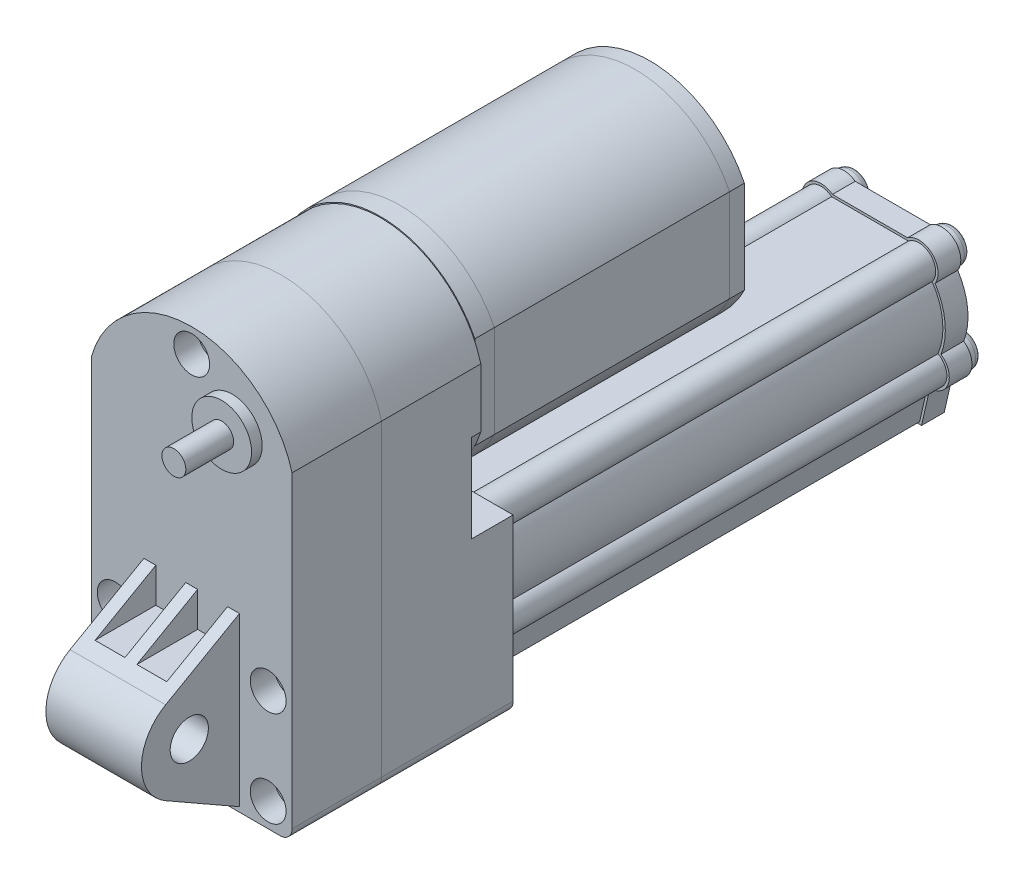
from build123d import *

# Parameters (mm, degrees)
BOSS_EXTRUDE1_DEPTH  = 19.05
SKETCH6_R            = 3.81
CUT_EXTRUDE2_DEPTH   = 5.08
SKETCH12_R           = 3.81
CUT_EXTRUDE3_DEPTH   = 5.08
BOSS_EXTRUDE11_DEPTH = 27.94
CUT_EXTRUDE4_DEPTH   = 8.89
CUT_EXTRUDE5_START   = -6.858
CUT_EXTRUDE5_DEPTH   = 6.858
BOSS_EXTRUDE13_DEPTH = 4.1402
BOSS_EXTRUDE14_DEPTH = 50
BOSS_EXTRUDE16_DEPTH = 3.1496
SKETCH26_R           = 11.938
BOSS_EXTRUDE17_DEPTH = 2.54
SKETCH27_R           = 11.938
BOSS_EXTRUDE20_DEPTH = 3.429
CHAMFER1_SIZE        = 2.286
FILLET11_R           = 2.54
CUT_EXTRUDE6_START   = -2.794
CUT_EXTRUDE6_DEPTH   = 2.794
BOSS_EXTRUDE21_DEPTH = 100
BOSS_EXTRUDE23_DEPTH = 4.826
SKETCH32_R           = 9.398
BOSS_EXTRUDE24_DEPTH = 8.128
SKETCH43_R           = 3.556
BOSS_EXTRUDE26_DEPTH = 2.54
FILLET13_R           = 1.27
SKETCH44_R           = 6.35
BOSS_EXTRUDE27_DEPTH = 2.2606
SKETCH45_R           = 2.54
BOSS_EXTRUDE28_DEPTH = 10.16
BOSS_EXTRUDE29_START = -11.176
SKETCH3_R            = 4.064
BOSS_EXTRUDE29_DEPTH = 20.32
SKETCH46_W           = 6.35
SKETCH46_H           = 7.366
CUT_EXTRUDE9_DEPTH   = 20.32
MOVE_START           = -1.75482957
MOVE_FACE1_DEPTH     = 20.32
MOVE_START_2         = 0.78517043
MOVE_FACE1_2_DEPTH   = 6.35
MOVE_START_3         = 9.67517043
MOVE_FACE1_3_DEPTH   = 6.35
MOVE_FACE1_4_DEPTH   = 20.32
MOVE_FACE1_5_DEPTH   = 2.54
MOVE_START_4         = 7.13517043
MOVE_FACE1_6_DEPTH   = 2.54
MOVE_START_5         = 16.02517043
MOVE_FACE1_7_DEPTH   = 2.54
FILLET14_R           = 2.54
FILLET15_R           = 2.54
SKETCH34_R           = 9.398
CUT_EXTRUDE11_DEPTH  = 185.928


# Read off the part's stored shape, not the designer's step: Cut-Extrude6, Move Face1
with BuildPart() as part:
    # Sketch1 → Boss-Extrude1 (new body)
    with BuildSketch(Plane.XY):
        with BuildLine():
            Line((-12.93082957, -18.491086285), (29.74117043, -18.491086285))
            Line((29.74117043, -18.491086285), (29.74117043, 49.580913715))
            ThreePointArc((29.74117043, 49.580913715), (8.40517043, 65.836892729), (-12.93082957, 49.580913715))
            Line((-12.93082957, 49.580913715), (-12.93082957, -18.491086285))
        make_face()
    extrude(amount=-BOSS_EXTRUDE1_DEPTH)

    # Sketch6 → Cut-Extrude2 (cut)
    with BuildSketch(Plane.XY):
        with Locations((-7.85082957, 6.908913715)):
            Circle(SKETCH6_R)
        with Locations((-7.85082957, -13.411086285)):
            Circle(SKETCH6_R)
        with Locations((24.66117043, 6.908913715)):
            Circle(SKETCH6_R)
        with Locations((24.66117043, -13.411086285)):
            Circle(SKETCH6_R)
    extrude(amount=-CUT_EXTRUDE2_DEPTH, mode=Mode.SUBTRACT)

    # Sketch12 → Cut-Extrude3 (cut)
    with BuildSketch(Plane.XY):
        with Locations((8.40517043, 60.756892729)):
            Circle(SKETCH12_R)
    extrude(amount=-CUT_EXTRUDE3_DEPTH, mode=Mode.SUBTRACT)

    # Sketch44 → Boss-Extrude27 (add)
    with BuildSketch(Plane.XY):
        with Locations(Location((17.04117043, 51.358913715, 0), (0, 0, 180))):
            Circle(SKETCH44_R)
    extrude(amount=BOSS_EXTRUDE27_DEPTH)

    # Sketch45 → Boss-Extrude28 (add)
    with BuildSketch(Plane.XY.offset(2.2606)):
        with Locations((17.04117043, 51.358913715)):
            Circle(SKETCH45_R)
    extrude(amount=BOSS_EXTRUDE28_DEPTH)

    # Sketch3 → Boss-Extrude29 (add)
    with BuildSketch(Plane.ZY.offset(12.93082957).offset(BOSS_EXTRUDE29_START)):
        with BuildLine():
            Line((0, -16.662286285), (0, 1.117779576))
            Line((0, 1.117779576), (0, 18.897713715))
            Line((0, 18.897713715), (15.701246407, 9.943459406))
            ThreePointArc((15.701246407, 9.943459406), (20.828056876, 1.117811735), (15.701302277, -7.70786839))
            Line((15.701302277, -7.70786839), (0, -16.662286285))
        make_face()
        with Locations((10.668054799, 1.117779576)):
            Circle(SKETCH3_R, mode=Mode.SUBTRACT)
    extrude(amount=-BOSS_EXTRUDE29_DEPTH)

    # Sketch46 → Cut-Extrude9 (cut)
    with BuildSketch(Plane.XY):
        with Locations((3.96017043, 15.214713715)):
            Rectangle(SKETCH46_W, SKETCH46_H)
        with Locations((12.85017043, 15.214713715)):
            Rectangle(SKETCH46_W, SKETCH46_H)
        with Locations((3.96017043, -12.979286285)):
            Rectangle(SKETCH46_W, SKETCH46_H)
        with Locations((12.85017043, -12.979286285)):
            Rectangle(SKETCH46_W, SKETCH46_H)
    extrude(amount=CUT_EXTRUDE9_DEPTH, mode=Mode.SUBTRACT)

    # Move Face1 outline → Move Face1 (cut)
    with BuildSketch(Plane.YZ.offset(MOVE_START)):
        with BuildLine():
            Line((9.140819406, 15.701246407), (18.095073715, 0))
            Line((18.095073715, 0), (18.897713715, 0))
            Line((18.897713715, 0), (9.943459406, 15.701246407))
            ThreePointArc((9.943459406, 15.701246407), (6.046592425, 19.552448201), (0.716459577, 20.820127714))
            ThreePointArc((0.716459577, 20.820127714), (5.591039303, 19.350826493), (9.140819406, 15.701246407))
        make_face()
        with BuildLine():
            ThreePointArc((0.716459576, 6.623918518), (-2.946220424, 10.668054799), (0.716459576, 14.71219108))
            ThreePointArc((0.716459576, 14.71219108), (-3.748860424, 10.668054799), (0.716459576, 6.623918518))
        make_face()
    extrude(amount=MOVE_FACE1_DEPTH, mode=Mode.SUBTRACT)

    # Move Face1 2 outline → Move Face1 2 (cut)
    with BuildSketch(Plane.YZ.offset(MOVE_START_2)):
        Polygon((11.531713715, 11.508823522), (10.729073716, 12.916249308), (10.729073715, 0), (11.531713715, 0), align=None)
    extrude(amount=MOVE_FACE1_2_DEPTH, mode=Mode.SUBTRACT)

    # Move Face1 3 outline → Move Face1 3 (cut)
    with BuildSketch(Plane.YZ.offset(MOVE_START_3)):
        Polygon((11.531713715, 11.508823522), (10.729073716, 12.916249308), (10.729073715, 0), (11.531713715, 0), align=None)
    extrude(amount=MOVE_FACE1_3_DEPTH, mode=Mode.SUBTRACT)

    # Move Face1 4 outline → Move Face1 4 (add)
    with BuildSketch(Plane.YZ.offset(MOVE_START)):
        with BuildLine():
            ThreePointArc((-7.70786839, 15.701302277), (-4.158092666, 19.350843192), (0.716459577, 20.820127714))
            ThreePointArc((0.716459577, 20.820127714), (-4.61364515, 19.552463801), (-8.51050839, 15.701302277))
            Line((-8.51050839, 15.701302277), (-10.098926285, 12.916059306))
            Line((-10.098926285, 12.916059306), (-10.098926285, 0))
            Line((-10.098926285, 0), (-9.296286285, 0))
            Line((-9.296286285, 0), (-9.296286285, 12.916059306))
            Line((-9.296286285, 12.916059306), (-7.70786839, 15.701302277))
        make_face()
        with BuildLine():
            ThreePointArc((0.716459576, 14.71219108), (4.379139576, 10.668054799), (0.716459576, 6.623918518))
            ThreePointArc((0.716459576, 6.623918518), (5.181779576, 10.668054799), (0.716459576, 14.71219108))
        make_face()
    extrude(amount=MOVE_FACE1_4_DEPTH)

    # Move Face1 5 outline → Move Face1 5 (add)
    with BuildSketch(Plane.YZ.offset(MOVE_START)):
        Polygon((-10.098926285, 11.508654222), (-10.098926285, 12.916059306), (-17.464926285, 0), (-16.662286285, 0), align=None)
    extrude(amount=MOVE_FACE1_5_DEPTH)

    # Move Face1 6 outline → Move Face1 6 (add)
    with BuildSketch(Plane.YZ.offset(MOVE_START_4)):
        Polygon((-10.098926285, 11.508654222), (-10.098926285, 12.916059306), (-17.464926285, 0), (-16.662286285, 0), align=None)
    extrude(amount=MOVE_FACE1_6_DEPTH)

    # Move Face1 7 outline → Move Face1 7 (add)
    with BuildSketch(Plane.YZ.offset(MOVE_START_5)):
        Polygon((-10.098926285, 11.508654222), (-10.098926285, 12.916059306), (-17.464926285, 0), (-16.662286285, 0), align=None)
    extrude(amount=MOVE_FACE1_7_DEPTH)

    # Fillet14
    fillet14_edges = [part.edges().sort_by_distance(p)[0] for p in [
        (29.74117043, -18.491086285, -9.525),
        (-12.93082957, -18.491086285, -9.525),
    ]]
    fillet(fillet14_edges, radius=FILLET14_R)


with BuildPart() as body_2:
    # Sketch17 → Boss-Extrude11 (new body)
    with BuildSketch(Plane(origin=(0, 0, -19.05), x_dir=(-1, 0, 0), z_dir=(0, 0, -1))):
        with BuildLine():
            Line((12.93082957, -18.491086285), (-29.74117043, -18.491086285))
            Line((-29.74117043, -18.491086285), (-29.74117043, 49.580913715))
            ThreePointArc((-29.74117043, 49.580913715), (-8.40517043, 65.836892729), (12.93082957, 49.580913715))
            Line((12.93082957, 49.580913715), (12.93082957, -18.491086285))
        make_face()
    extrude(amount=BOSS_EXTRUDE11_DEPTH)

    # Sketch18 → Cut-Extrude4 (cut)
    with BuildSketch(Plane(origin=(0, 0, -46.99), x_dir=(-1, 0, 0), z_dir=(0, 0, -1))):
        with BuildLine():
            Line((-29.74117043, 18.338913715), (12.93082957, 18.338913715))
            Line((12.93082957, 18.338913715), (12.93082957, 37.044777605))
            ThreePointArc((12.93082957, 37.044777605), (-8.40517043, 21.355135146), (-29.74117043, 37.044777605))
            Line((-29.74117043, 37.044777605), (-29.74117043, 18.338913715))
        make_face()
    extrude(amount=-CUT_EXTRUDE4_DEPTH, mode=Mode.SUBTRACT)

    # Sketch18<5> → Cut-Extrude5 (cut)
    with BuildSketch(Plane(origin=(0, 0, -46.99), x_dir=(-1, 0, 0), z_dir=(0, 0, -1)).offset(CUT_EXTRUDE5_START)):
        with BuildLine():
            Line((12.93082957, 49.580913715), (12.93082957, 37.044777605))
            ThreePointArc((12.93082957, 37.044777605), (13.691369751, 40.337444359), (13.94682957, 43.707135146))
            ThreePointArc((13.94682957, 43.707135146), (-11.774861217, 65.803675328), (-29.74117043, 37.044777605))
            Line((-29.74117043, 37.044777605), (-29.74117043, 49.580913715))
            ThreePointArc((-29.74117043, 49.580913715), (-8.40517043, 65.836892729), (12.93082957, 49.580913715))
        make_face()
        with BuildLine():
            ThreePointArc((-29.74117043, 37.044777605), (-8.40517043, 21.355135146), (12.93082957, 37.044777605))
            Line((12.93082957, 37.044777605), (12.93082957, 49.580913715))
            ThreePointArc((12.93082957, 49.580913715), (-8.40517043, 65.836892729), (-29.74117043, 49.580913715))
            Line((-29.74117043, 49.580913715), (-29.74117043, 37.044777605))
        make_face()
    extrude(amount=CUT_EXTRUDE5_DEPTH, mode=Mode.SUBTRACT)

    # Cut-Extrude6 outline → Cut-Extrude6 (cut)
    with BuildSketch(Plane(origin=(0, 0, -46.99), x_dir=(-1, 0, 0), z_dir=(0, 0, -1)).offset(CUT_EXTRUDE6_START)):
        with BuildLine():
            ThreePointArc((-16.567972961, 13.571054992), (-21.299133174, 13.349170074), (-21.61317043, 8.623232021))
            ThreePointArc((-21.61317043, 8.623232021), (-23.83485908, 2.454274355), (-22.858312088, -4.029420203))
            ThreePointArc((-22.858312088, -4.029420203), (-24.684009124, -7.803496663), (-21.646586083, -10.693286285))
            Line((-21.646586083, -10.693286285), (-20.72417043, -10.693286285))
            Line((-20.72417043, -10.693286285), (-18.94617043, -18.491086285))
            Line((-18.94617043, -18.491086285), (2.13582957, -18.491086285))
            Line((2.13582957, -18.491086285), (3.91382957, -10.693286285))
            ThreePointArc((3.91382957, -10.693286285), (7.761606127, -8.251890338), (6.047971228, -4.029420203))
            ThreePointArc((6.047971228, -4.029420203), (6.826033776, -1.49449173), (7.08882957, 1.144102983))
            Line((7.08882957, 1.144102983), (7.088819872, 1.160210788))
            ThreePointArc((7.088819872, 1.160210788), (6.502214683, 5.062148637), (4.80282957, 8.623232021))
            ThreePointArc((4.80282957, 8.623232021), (4.488792314, 13.349170074), (-0.242367899, 13.571054992))
            Line((-0.242367899, 13.571054992), (-16.567972961, 13.571054992))
        make_face()
    extrude(amount=CUT_EXTRUDE6_DEPTH, mode=Mode.SUBTRACT)

    # Fillet15
    fillet15_edges = [body_2.edges().sort_by_distance(p)[0] for p in [
        (-12.93082957, -18.491086285, -33.02),
        (29.74117043, -18.491086285, -33.02),
    ]]
    fillet(fillet15_edges, radius=FILLET15_R)


with BuildPart() as body_3:
    # Sketch23 → Boss-Extrude13 (new body)
    with BuildSketch(Plane(origin=(0, 0, -40.132), x_dir=(-1, 0, 0), z_dir=(0, 0, -1))):
        with BuildLine():
            Line((11.66082957, 43.707135146), (11.66082957, 33.859924983))
            ThreePointArc((11.66082957, 33.859924983), (-8.40517043, 21.355135146), (-28.47117043, 33.859924983))
            Line((-28.47117043, 33.859924983), (-28.47117043, 43.707135146))
            Line((-28.47117043, 43.707135146), (-28.47117043, 53.554345309))
            ThreePointArc((-28.47117043, 53.554345309), (-8.40517043, 66.059135146), (11.66082957, 53.554345309))
            Line((11.66082957, 53.554345309), (11.66082957, 43.707135146))
        make_face()
    extrude(amount=BOSS_EXTRUDE13_DEPTH)


with BuildPart() as body_4:
    # Sketch24 → Boss-Extrude14 (new body)
    with BuildSketch(Plane(origin=(0, 0, -44.2722), x_dir=(-1, 0, 0), z_dir=(0, 0, -1))):
        with BuildLine():
            Line((11.66082957, 33.859924983), (11.66082957, 53.554345309))
            ThreePointArc((11.66082957, 53.554345309), (-8.40517043, 66.059135146), (-28.47117043, 53.554345309))
            Line((-28.47117043, 53.554345309), (-28.47117043, 33.859924983))
            ThreePointArc((-28.47117043, 33.859924983), (-8.40517043, 21.355135146), (11.66082957, 33.859924983))
        make_face()
    extrude(amount=BOSS_EXTRUDE14_DEPTH)


with BuildPart() as body_5:
    # Sketch25 → Boss-Extrude16 (new body)
    with BuildSketch(Plane(origin=(0, 0, -94.2722), x_dir=(-1, 0, 0), z_dir=(0, 0, -1))):
        with BuildLine():
            Line((11.66082957, 33.859924983), (11.66082957, 53.554345309))
            ThreePointArc((11.66082957, 53.554345309), (-8.40517043, 66.059135146), (-28.47117043, 53.554345309))
            Line((-28.47117043, 53.554345309), (-28.47117043, 33.859924983))
            ThreePointArc((-28.47117043, 33.859924983), (-8.40517043, 21.355135146), (11.66082957, 33.859924983))
        make_face()
    extrude(amount=BOSS_EXTRUDE16_DEPTH)

    # Sketch26 → Boss-Extrude17 (add)
    with BuildSketch(Plane(origin=(0, 0, -97.4218), x_dir=(-1, 0, 0), z_dir=(0, 0, -1))):
        with Locations((-8.40517043, 43.707135146)):
            Circle(SKETCH26_R)
    extrude(amount=BOSS_EXTRUDE17_DEPTH)


with BuildPart() as body_6:
    # Sketch27 → Boss-Extrude20 (new body)
    with BuildSketch(Plane(origin=(0, 0, -99.9618), x_dir=(-1, 0, 0), z_dir=(0, 0, -1))):
        with Locations((-8.40517043, 43.707135146)):
            Circle(SKETCH27_R)
    extrude(amount=BOSS_EXTRUDE20_DEPTH)

    # Chamfer1
    chamfer1_edges = [body_6.edges().sort_by_distance(p)[0] for p in [
        (20.34317043, 43.707135146, -103.3908),
    ]]
    chamfer(chamfer1_edges, length=CHAMFER1_SIZE)

    # Fillet11
    fillet11_edges = [body_6.edges().sort_by_distance(p)[0] for p in [
        (20.34317043, 43.707135146, -101.1048),
    ]]
    fillet(fillet11_edges, radius=FILLET11_R)


with BuildPart() as body_7:
    # Sketch30 → Boss-Extrude21 (new body)
    with BuildSketch(Plane(origin=(0, 0, -44.196), x_dir=(-1, 0, 0), z_dir=(0, 0, -1))):
        with BuildLine():
            Line((-20.72417043, -10.693286285), (-18.94617043, -18.491086285))
            Line((-18.94617043, -18.491086285), (2.13582957, -18.491086285))
            Line((2.13582957, -18.491086285), (3.91382957, -10.693286285))
            ThreePointArc((3.91382957, -10.693286285), (7.761606127, -8.251890338), (6.047971228, -4.029420203))
            ThreePointArc((6.047971228, -4.029420203), (7.024528052, 2.454275322), (4.80282957, 8.623232021))
            ThreePointArc((4.80282957, 8.623232021), (4.488792314, 13.349170074), (-0.242367899, 13.571054992))
            Line((-0.242367899, 13.571054992), (-16.567972961, 13.571054992))
            ThreePointArc((-16.567972961, 13.571054992), (-21.299133174, 13.349170074), (-21.61317043, 8.623232021))
            ThreePointArc((-21.61317043, 8.623232021), (-23.83485908, 2.454274355), (-22.858312088, -4.029420203))
            ThreePointArc((-22.858312088, -4.029420203), (-24.571946987, -8.251890338), (-20.72417043, -10.693286285))
        make_face()
    extrude(amount=BOSS_EXTRUDE21_DEPTH)


with BuildPart() as body_8:
    # Sketch31 → Boss-Extrude23 (new body)
    with BuildSketch(Plane(origin=(0, 0, -144.196), x_dir=(-1, 0, 0), z_dir=(0, 0, -1))):
        with BuildLine():
            Line((-0.415899, 14.079054992), (-16.394441861, 14.079054992))
            ThreePointArc((-16.394441861, 14.079054992), (-21.588241548, 13.775696815), (-22.227712388, 8.612494473))
            ThreePointArc((-22.227712388, 8.612494473), (-24.336184911, 2.546364848), (-23.489636452, -3.819712493))
            ThreePointArc((-23.489636452, -3.819712493), (-25.056721349, -8.403768093), (-21.122639806, -11.230837818))
            Line((-21.122639806, -11.230837818), (-19.351377941, -18.999086285))
            Line((-19.351377941, -18.999086285), (2.54103708, -18.999086285))
            Line((2.54103708, -18.999086285), (4.312298946, -11.230837818))
            ThreePointArc((4.312298946, -11.230837818), (8.246380489, -8.403768093), (6.679295591, -3.819712493))
            ThreePointArc((6.679295591, -3.819712493), (7.52584405, 2.546364848), (5.417371527, 8.612494473))
            ThreePointArc((5.417371527, 8.612494473), (4.777900687, 13.775696815), (-0.415899, 14.079054992))
        make_face()
    extrude(amount=BOSS_EXTRUDE23_DEPTH)



with BuildPart() as body_9:
    # Sketch32 → Boss-Extrude24 (new body)
    with BuildSketch(Plane(origin=(0, 0, -149.022), x_dir=(-1, 0, 0), z_dir=(0, 0, -1))):
        with Locations((-8.40517043, 0.312983004)):
            Circle(SKETCH32_R)
    extrude(amount=BOSS_EXTRUDE24_DEPTH)


with BuildPart() as body_8_1:
    add(body_8.part)

    add(body_9.part)  # Boss-Extrude26 merges body 9
    # Sketch43 → Boss-Extrude26 (add)
    with BuildSketch(Plane(origin=(0, 0, -149.022), x_dir=(-1, 0, 0), z_dir=(0, 0, -1))):
        with Locations((-18.809281307, 10.810317247)):
            Circle(SKETCH43_R)
        with Locations((1.998940446, 10.810317247)):
            Circle(SKETCH43_R)
        with Locations((-21.185378257, -7.167322113)):
            Circle(SKETCH43_R)
        with Locations((4.375037396, -7.167322113)):
            Circle(SKETCH43_R)
    extrude(amount=BOSS_EXTRUDE26_DEPTH)

    # Fillet13
    fillet13_edges = [body_8_1.edges().sort_by_distance(p)[0] for p in [
        (22.365281307, 10.810317247, -151.562),
        (1.557059554, 10.810317247, -151.562),
        (24.741378257, -7.167322113, -151.562),
        (-0.819037396, -7.167322113, -151.562),
    ]]
    fillet(fillet13_edges, radius=FILLET13_R)


with BuildPart() as cut_extrude11_tool:
    # Sketch34 → Cut-Extrude11 (new body)
    with BuildSketch(Plane(origin=(0, 0, -157.15), x_dir=(-1, 0, 0), z_dir=(0, 0, -1))):
        with Locations((-8.40517043, 0.312983004)):
            Circle(SKETCH34_R)
    extrude(amount=-CUT_EXTRUDE11_DEPTH)


with BuildPart() as body_7_1:
    add(body_7.part)

    # Cut-Extrude11: cut by cut_extrude11_tool
    add(cut_extrude11_tool.part, mode=Mode.SUBTRACT)


with BuildPart() as body_8_2:
    add(body_8_1.part)

    # Cut-Extrude11: cut by cut_extrude11_tool
    add(cut_extrude11_tool.part, mode=Mode.SUBTRACT)


solid = Compound([part.part, body_2.part, body_3.part, body_4.part, body_5.part, body_6.part, body_7_1.part, body_8_2.part])
